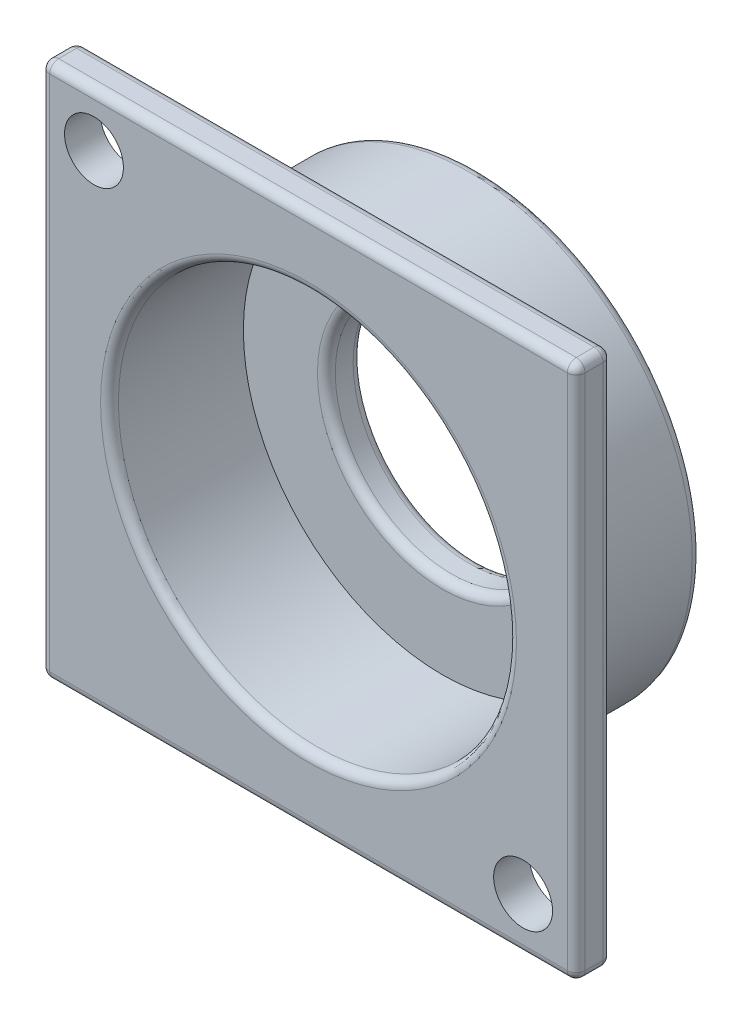
from build123d import *

# Parameters (mm, degrees)
SKETCH1_W           = 30
SKETCH1_H           = 30
SKETCH1_R           = 11.15
SKETCH1_R_2         = 1.65
BOSS_EXTRUDE1_DEPTH = 2
SKETCH1_3_R         = 12.5
SKETCH1_3_R_2       = 11.15
BOSS_EXTRUDE2_DEPTH = 7.5
SKETCH2_R           = 12.5
SKETCH2_R_2         = 6.5
BOSS_EXTRUDE3_DEPTH = 2
FILLET1_R           = 0.5


with BuildPart() as part:
    # Sketch1 → Boss-Extrude1 (new body)
    with BuildSketch(Plane.XY):
        Rectangle(SKETCH1_W, SKETCH1_H)
        Circle(SKETCH1_R, mode=Mode.SUBTRACT)
        with Locations((12.02081528, -12.02081528)):
            Circle(SKETCH1_R_2, mode=Mode.SUBTRACT)
        with Locations((-12.02081528, 12.02081528)):
            Circle(SKETCH1_R_2, mode=Mode.SUBTRACT)
    extrude(amount=-BOSS_EXTRUDE1_DEPTH)

    # Sketch1<3> → Boss-Extrude2 (add)
    with BuildSketch(Plane.XY):
        Circle(SKETCH1_3_R)
        Circle(SKETCH1_3_R_2, mode=Mode.SUBTRACT)
    extrude(amount=-BOSS_EXTRUDE2_DEPTH)

    # Sketch2 → Boss-Extrude3 (add)
    with BuildSketch(Plane(origin=(0, 0, -7.5), x_dir=(-1, 0, 0), z_dir=(0, 0, -1))):
        Circle(SKETCH2_R)
        Circle(SKETCH2_R_2, mode=Mode.SUBTRACT)
    extrude(amount=BOSS_EXTRUDE3_DEPTH)

    # Fillet1
    fillet1_edges = [part.edges().sort_by_distance(p)[0] for p in [
        (0, -15, -2),
        (0, -15, 0),
        (-15, -15, -1),
        (-15, 0, -2),
        (-15, 0, 0),
        (-15, 15, -1),
        (0, 15, -2),
        (0, 15, 0),
        (15, 15, -1),
        (15, 0, -2),
        (15, -15, -1),
        (15, 0, 0),
        (-11.15, 0, 0),
        (12.5, 0, -9.5),
        (6.5, 0, -7.5),
        (6.5, 0, -9.5),
    ]]
    fillet(fillet1_edges, radius=FILLET1_R)


solid = part.part
